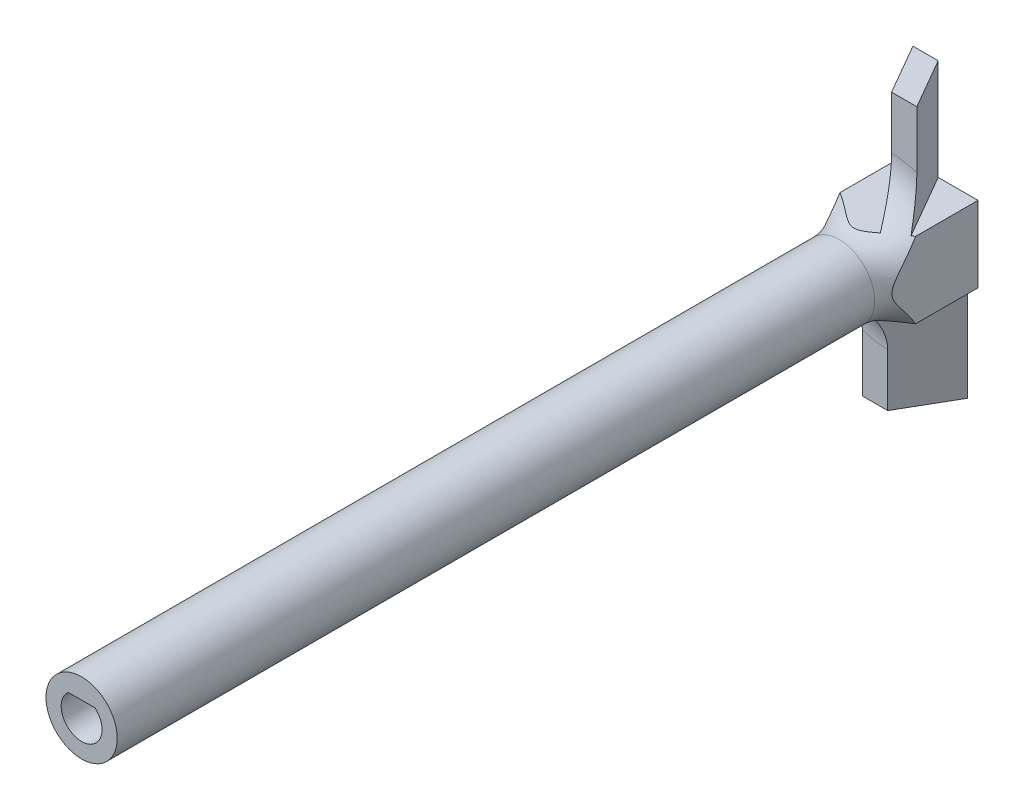
from build123d import *

# Parameters (mm, degrees)
SKETCH1_R           = 7.05
SKETCH1_R_2         = 4.05
BOSS_EXTRUDE1_DEPTH = 160
SKETCH3_W           = 15
SKETCH3_H           = 15
BOSS_EXTRUDE2_DEPTH = 10
BOSS_EXTRUDE3_DEPTH = 20
CIRPATTERN1_COUNT   = 2
FILLET1_R           = 10
CUT_EXTRUDE2_DEPTH  = 40
SKETCH6_R           = 2
CUT_EXTRUDE3_DEPTH  = 173.37314178
SKETCH7_R           = 3.75
CUT_EXTRUDE4_DEPTH  = 4


with BuildPart() as part:
    # Sketch1 → Boss-Extrude1 (new body)
    # profile 1 of 2: a face of its own
    with BuildSketch(Plane.XY):
        Circle(SKETCH1_R)
        Circle(SKETCH1_R_2, mode=Mode.SUBTRACT)
    # profile 2 of 2: a face of its own
    with BuildSketch(Plane.XY):
        Circle(SKETCH1_R_2)
    extrude(amount=BOSS_EXTRUDE1_DEPTH)

    # Sketch3 → Boss-Extrude2 (add)
    with BuildSketch(Plane(origin=(0, 0, 0), x_dir=(-1, 0, 0), z_dir=(0, 0, -1))):
        Rectangle(SKETCH3_W, SKETCH3_H)
    extrude(amount=BOSS_EXTRUDE2_DEPTH)

    # Sketch4 → Boss-Extrude3 (add)
    with BuildSketch(Plane(origin=(0, 7.5, 0), x_dir=(1, 0, 0), z_dir=(0, 1, 0))):
        Polygon((-0.386751346, 10), (5.386751346, 0), (0.386751346, 0), (-5.386751346, 10), align=None)
    boss_extrude3 = extrude(amount=BOSS_EXTRUDE3_DEPTH)

    # CirPattern1: Boss-Extrude3 ×2 about axis
    cirpattern1_axis = Axis((0, 0, 0), (0, 0, 1))
    for i in range(1, CIRPATTERN1_COUNT):
        add(boss_extrude3.rotate(cirpattern1_axis, i * 360 / CIRPATTERN1_COUNT))

    # Fillet1
    # the kernel refuses this fillet: 10 mm, written as the material it adds along each edge
    with BuildSketch(Plane(origin=(0, 0, 0), x_dir=(1, 0, 0), z_dir=(0, -1, 0))) as fillet1_piece_1_section:
        with BuildLine():
            CenterArc((7.05 + FILLET1_R, FILLET1_R), FILLET1_R, 180, 90)
            Line((7.05, FILLET1_R), (7.05, 0))
            Line((7.05, 0), (7.05 + FILLET1_R, 0))
        make_face()
    fillet1_piece_1 = revolve(axis=Axis((0, 0, 0), (0, 0, 1)), mode=Mode.PRIVATE)
    fillet1_piece_1 = split(fillet1_piece_1, bisect_by=Plane(origin=(7.384958352, 7.5, 2.9516764), z_dir=(0, -1, 0)), keep=Keep.TOP, mode=Mode.PRIVATE)
    fillet1_piece_1 = split(fillet1_piece_1, bisect_by=Plane(origin=(7.5, 6.602416729, 2.9516764), z_dir=(-1, 0, 0)), keep=Keep.TOP, mode=Mode.PRIVATE)
    fillet1_piece_1 = split(fillet1_piece_1, bisect_by=Plane(origin=(-7.5, 6.602416729, 2.9516764), z_dir=(1, 0, 0)), keep=Keep.TOP, mode=Mode.PRIVATE)
    fillet1_piece_1 = split(fillet1_piece_1, bisect_by=Plane(origin=(7.384958352, -7.5, 2.9516764), z_dir=(0, 1, 0)), keep=Keep.TOP, mode=Mode.PRIVATE)
    add(fillet1_piece_1)
    with BuildSketch(Plane(origin=(0, 0, 0), x_dir=(1, 0, 0), z_dir=(0, -1, 0))) as fillet1_piece_2_section:
        with BuildLine():
            CenterArc((7.05 + FILLET1_R, FILLET1_R), FILLET1_R, 180, 90)
            Line((7.05, FILLET1_R), (7.05, 0))
            Line((7.05, 0), (7.05 + FILLET1_R, 0))
        make_face()
    fillet1_piece_2 = revolve(axis=Axis((0, 0, 0), (0, 0, 1)), mode=Mode.PRIVATE)
    fillet1_piece_2 = split(fillet1_piece_2, bisect_by=Plane(origin=(5.410380514, 9.830478865, 0.040926919), z_dir=(-0.8660254037844362, 0, 0.5000000000000043)), keep=Keep.TOP, mode=Mode.PRIVATE)
    fillet1_piece_2 = split(fillet1_piece_2, bisect_by=Plane(origin=(7.5, 9.830478865, 1.235681154), z_dir=(-1, 0, 0)), keep=Keep.TOP, mode=Mode.PRIVATE)
    fillet1_piece_2 = split(fillet1_piece_2, bisect_by=Plane(origin=(1.660380514, 9.830478865, 2.205990428), z_dir=(0.8660254037844359, 0, -0.5000000000000047)), keep=Keep.TOP, mode=Mode.PRIVATE)
    fillet1_piece_2 = split(fillet1_piece_2, bisect_by=Plane(origin=(3.341005476, -7.5, 1.235681154), z_dir=(0, 1, 0)), keep=Keep.TOP, mode=Mode.PRIVATE)
    add(fillet1_piece_2)
    with BuildSketch(Plane(origin=(0, 0, 0), x_dir=(1, 0, 0), z_dir=(0, -1, 0))) as fillet1_piece_3_section:
        with BuildLine():
            CenterArc((7.05 + FILLET1_R, FILLET1_R), FILLET1_R, 180, 90)
            Line((7.05, FILLET1_R), (7.05, 0))
            Line((7.05, 0), (7.05 + FILLET1_R, 0))
        make_face()
    fillet1_piece_3 = revolve(axis=Axis((0, 0, 0), (0, 0, 1)), mode=Mode.PRIVATE)
    fillet1_piece_3 = split(fillet1_piece_3, bisect_by=Plane(origin=(-3.341005467, -7.5, 1.235681156), z_dir=(0, -1, 0)), keep=Keep.TOP, mode=Mode.PRIVATE)
    fillet1_piece_3 = split(fillet1_piece_3, bisect_by=Plane(origin=(-5.410380512, -9.830478864, 0.040926917), z_dir=(0.8660254037844362, 0, 0.5000000000000043)), keep=Keep.TOP, mode=Mode.PRIVATE)
    fillet1_piece_3 = split(fillet1_piece_3, bisect_by=Plane(origin=(-1.660380512, -9.830478864, 2.205990426), z_dir=(-0.8660254037844359, 0, -0.5000000000000047)), keep=Keep.TOP, mode=Mode.PRIVATE)
    add(fillet1_piece_3)

    # Sketch5 → Cut-Extrude2 (cut)
    with BuildSketch(Plane.XY.offset(160)):
        with BuildLine():
            Line((2.664582519, 3.05), (-2.664582519, 3.05))
            ThreePointArc((-2.664582519, 3.05), (0, -4.05), (2.664582519, 3.05))
        make_face()
    extrude(amount=-CUT_EXTRUDE2_DEPTH, mode=Mode.SUBTRACT)

    # Sketch6 → Cut-Extrude3 (cut, through all)
    with BuildSketch(Plane(origin=(0, 0, -10), x_dir=(-1, 0, 0), z_dir=(0, 0, -1))):
        Circle(SKETCH6_R)
    extrude(amount=-CUT_EXTRUDE3_DEPTH, mode=Mode.SUBTRACT)

    # Sketch7 → Cut-Extrude4 (cut)
    with BuildSketch(Plane(origin=(0, 0, -10), x_dir=(-1, 0, 0), z_dir=(0, 0, -1))):
        Circle(SKETCH7_R)
    extrude(amount=-CUT_EXTRUDE4_DEPTH, mode=Mode.SUBTRACT)


solid = part.part
